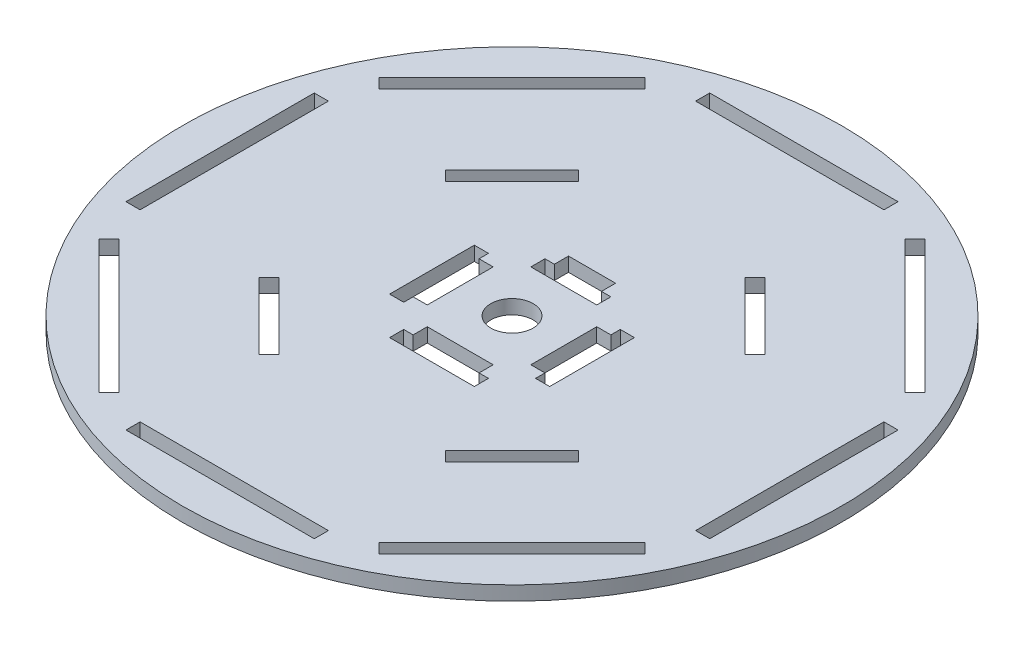
from build123d import *

# Parameters (mm, degrees)
CROQUIS1_R              = 70
CROQUIS1_R_2            = 4.5
SALIENTE_EXTRUIR1_DEPTH = 3


with BuildPart() as part:
    # Croquis1 → Saliente-Extruir1 (new body)
    with BuildSketch(Plane(origin=(0, 0, 0), x_dir=(1, 0, 0), z_dir=(0, 1, 0))):
        Circle(CROQUIS1_R)
        Circle(CROQUIS1_R_2, mode=Mode.SUBTRACT)
        Polygon((0, 11), (7, 11), (7, 14), (5, 14), (5, 17), (0, 17), (-5, 17), (-5, 14), (-7, 14), (-7, 11), align=None, mode=Mode.SUBTRACT)
        Polygon((24.748737342, 24.748737342), (31.819805153, 17.67766953), (33.941125497, 19.798989873), (19.798989873, 33.941125497), (17.67766953, 31.819805153), align=None, mode=Mode.SUBTRACT)
        Polygon((11, 0), (11, 7), (14, 7), (14, 9), (17, 9), (17, 0), (17, -9), (14, -9), (14, -7), (11, -7), align=None, mode=Mode.SUBTRACT)
        Polygon((-24.748737342, 24.748737342), (-17.67766953, 31.819805153), (-19.798989873, 33.941125497), (-33.941125497, 19.798989873), (-31.819805153, 17.67766953), align=None, mode=Mode.SUBTRACT)
        Polygon((-14, -7), (-11, -7), (-11, 0), (-11, 7), (-14, 7), (-14, 9), (-17, 9), (-17, 0), (-17, -9), (-14, -9), align=None, mode=Mode.SUBTRACT)
        Polygon((-7, -14), (-9, -14), (-9, -17), (0, -17), (9, -17), (9, -14), (7, -14), (7, -11), (0, -11), (-7, -11), align=None, mode=Mode.SUBTRACT)
        Polygon((24.748737342, -24.748737342), (17.67766953, -31.819805153), (19.798989873, -33.941125497), (33.941125497, -19.798989873), (31.819805153, -17.67766953), align=None, mode=Mode.SUBTRACT)
        Polygon((-24.748737342, -24.748737342), (-31.819805153, -17.67766953), (-33.941125497, -19.798989873), (-19.798989873, -33.941125497), (-17.67766953, -31.819805153), align=None, mode=Mode.SUBTRACT)
        Polygon((0, 62), (20, 62), (20, 59), (-20, 59), (-20, 62), align=None, mode=Mode.SUBTRACT)
        Polygon((55.861435714, 27.577164466), (27.577164466, 55.861435714), (29.69848481, 57.982756057), (43.840620434, 43.840620434), (57.982756057, 29.69848481), align=None, mode=Mode.SUBTRACT)
        Polygon((59, -20), (59, 20), (62, 20), (62, 0), (62, -20), align=None, mode=Mode.SUBTRACT)
        Polygon((27.577164466, -55.861435714), (55.861435714, -27.577164466), (57.982756057, -29.69848481), (43.840620434, -43.840620434), (29.69848481, -57.982756057), align=None, mode=Mode.SUBTRACT)
        Polygon((-20, -59), (20, -59), (20, -62), (0, -62), (-20, -62), align=None, mode=Mode.SUBTRACT)
        Polygon((-55.861435714, -27.577164466), (-27.577164466, -55.861435714), (-29.69848481, -57.982756057), (-43.840620434, -43.840620434), (-57.982756057, -29.69848481), align=None, mode=Mode.SUBTRACT)
        Polygon((-59, 20), (-59, -20), (-62, -20), (-62, 0), (-62, 20), align=None, mode=Mode.SUBTRACT)
        Polygon((-27.577164466, 55.861435714), (-55.861435714, 27.577164466), (-57.982756057, 29.69848481), (-43.840620434, 43.840620434), (-29.69848481, 57.982756057), align=None, mode=Mode.SUBTRACT)
    extrude(amount=SALIENTE_EXTRUIR1_DEPTH)


solid = part.part
